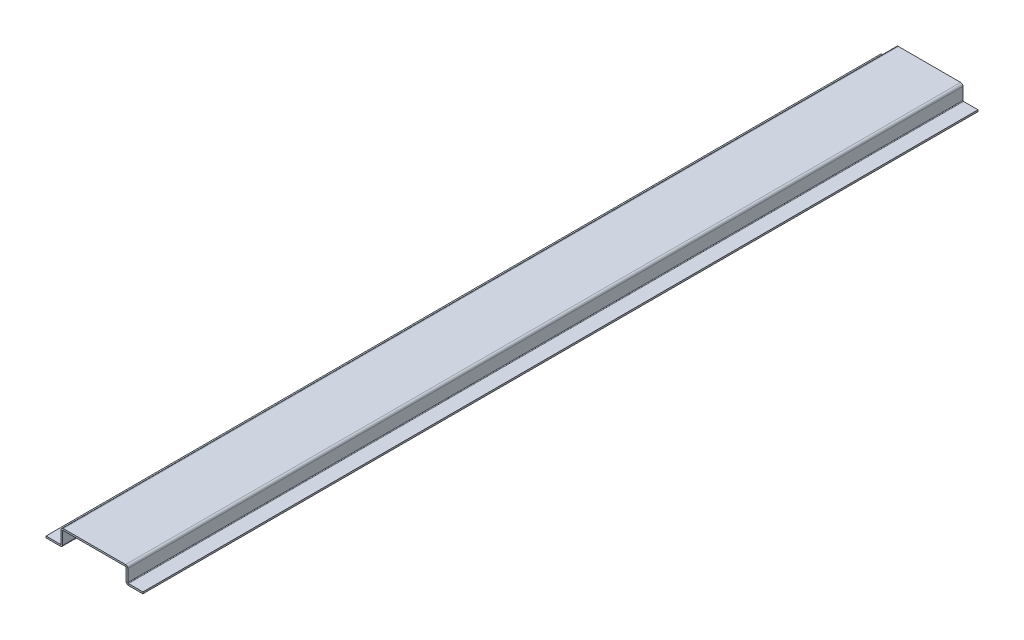
from build123d import *

# Parameters (mm, degrees)
BASE_DEPTH = 1000


# Sheet-metal steps are written as plain solids
with BuildPart() as part:
    # Sketch1 → Base (new body)
    with BuildSketch(Plane.XY):
        with BuildLine():
            Line((-58, -18), (-40.7366, -18))
            ThreePointArc((-40.7366, -18), (-38.801531583, -17.198468417), (-38, -15.2634))
            Line((-38, -15.2634), (-38, -0.7366))
            ThreePointArc((-38, -0.7366), (-37.784254855, -0.215745145), (-37.2634, 0))
            Line((-37.2634, 0), (37.2634, 0))
            ThreePointArc((37.2634, 0), (37.784254855, -0.215745145), (38, -0.7366))
            Line((38, -0.7366), (38, -15.2634))
            ThreePointArc((38, -15.2634), (38.801531583, -17.198468417), (40.7366, -18))
            Line((40.7366, -18), (58, -18))
            Line((58, -18), (58, -16))
            Line((58, -16), (40.7366, -16))
            ThreePointArc((40.7366, -16), (40.215745145, -15.784254855), (40, -15.2634))
            Line((40, -15.2634), (40, -0.7366))
            ThreePointArc((40, -0.7366), (39.198468417, 1.198468417), (37.2634, 2))
            Line((37.2634, 2), (-37.2634, 2))
            ThreePointArc((-37.2634, 2), (-39.198468417, 1.198468417), (-40, -0.7366))
            Line((-40, -0.7366), (-40, -15.2634))
            ThreePointArc((-40, -15.2634), (-40.215745145, -15.784254855), (-40.7366, -16))
            Line((-40.7366, -16), (-58, -16))
            Line((-58, -16), (-58, -18))
        make_face()
    extrude(amount=-BASE_DEPTH)


solid = part.part
